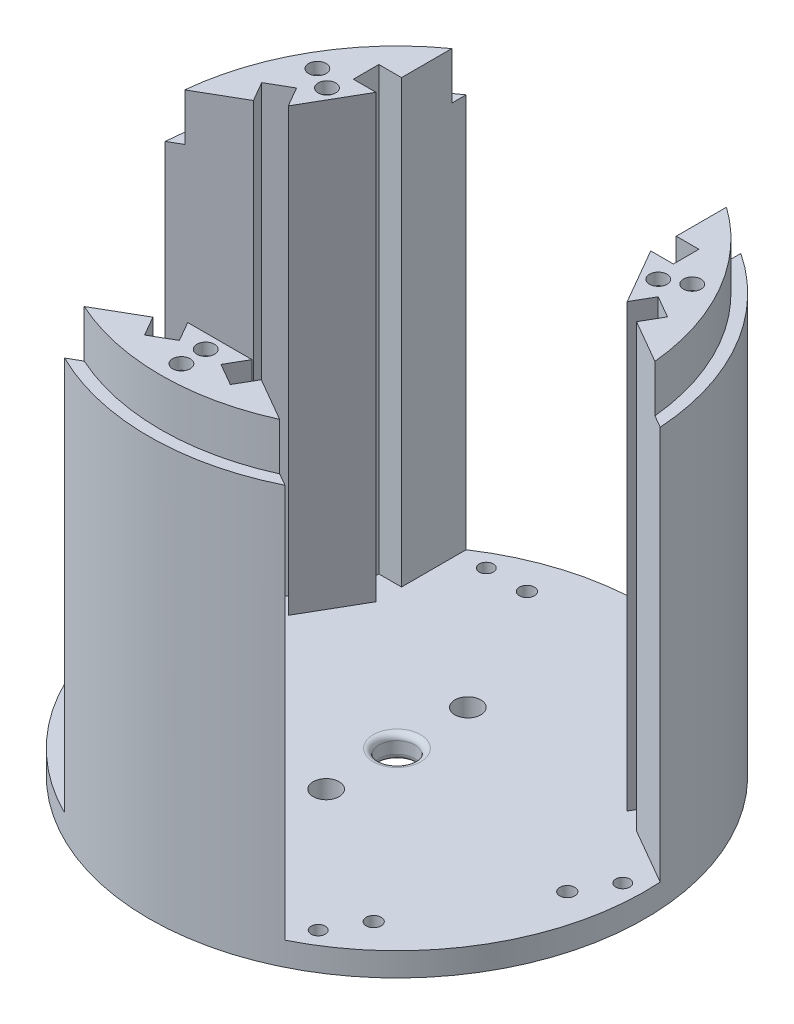
from build123d import *

# Parameters (mm, degrees)
SKETCH1_R             = 66.675
BOSS_EXTRUDE1_DEPTH   = 6.35
BOSS_EXTRUDE2_REACH   = 240.306
CIRPATTERN1_COUNT     = 3
CUT_EXTRUDE1_DEPTH    = 118.618
CIRPATTERN2_COUNT     = 3
CUT_EXTRUDE2_DEPTH    = 12.7
CIRPATTERN3_COUNT     = 3
HOLE1_D               = 4.0386
CIRPATTERN4_OUTLINE_R = 2.0193
CIRPATTERN4_DEPTH     = 6.35
HOLE2_D               = 9.525
FILLET1_R             = 1.5875
HOLE3_D               = 6.985
CIRPATTERN5_COUNT     = 3
HOLE5_D               = 3.7973
CIRPATTERN6_COUNT     = 3
CIRPATTERN7_COUNT     = 3


# Read off the part's stored shape, not the designer's step: CirPattern4
with BuildPart() as part:
    # Sketch1 → Boss-Extrude1 (new body)
    with BuildSketch(Plane(origin=(0, 0, 0), x_dir=(1, 0, 0), z_dir=(0, 1, 0))):
        with Locations(Location((0, 0, 0), (0, 0, 270))):
            Circle(SKETCH1_R)
    extrude(amount=BOSS_EXTRUDE1_DEPTH)

    # Sketch2 → Boss-Extrude2 (add, up to next)
    with BuildSketch(Plane(origin=(0, 124.968, -124.968), x_dir=(1, 0, 0), z_dir=(0, -1, 0)), mode=Mode.PRIVATE) as boss_extrude2_sk1:
        with BuildLine():
            Line((-29.614770643, 184.705098882), (-8.635999998, 172.593000013))
            Line((-8.635999998, 172.593000013), (8.636000002, 172.593000013))
            Line((8.636000002, 172.593000013), (29.61477065, 184.705098878))
            ThreePointArc((29.61477065, 184.705098878), (4e-09, 191.642999985), (-29.614770643, 184.705098882))
        make_face()
    boss_extrude2_tool1 = extrude(boss_extrude2_sk1.sketch, amount=BOSS_EXTRUDE2_REACH, mode=Mode.PRIVATE) - part.part
    boss_extrude2 = boss_extrude2_tool1.solids().sort_by_distance((0, 124.968, 57.682703))[0]
    add(boss_extrude2)

    # CirPattern1: Boss-Extrude2 ×3 about axis
    cirpattern1_axis = Axis((0, 0, 0), (0, 1, 0))
    for i in range(1, CIRPATTERN1_COUNT):
        add(boss_extrude2.rotate(cirpattern1_axis, i * 360 / CIRPATTERN1_COUNT))

    # Sketch4 → Cut-Extrude1 (cut)
    with BuildSketch(Plane(origin=(0, 124.968, 0), x_dir=(1, 0, 0), z_dir=(0, 1, 0))):
        Polygon((14.575202222, -51.054000013), (11.527202222, -56.333290875), (5.588000002, -52.904290875), (8.636000002, -47.625000013), align=None)
        Polygon((-14.575202225, -51.054000007), (-8.635999998, -47.625000013), (-5.587999998, -52.904290875), (-11.527202221, -56.333290877), align=None)
    cut_extrude1 = extrude(amount=-CUT_EXTRUDE1_DEPTH, mode=Mode.SUBTRACT)

    # CirPattern2: Cut-Extrude1 ×3 about axis
    cirpattern2_axis = Axis((0, 0, 0), (0, 1, 0))
    for i in range(1, CIRPATTERN2_COUNT):
        add(cut_extrude1.rotate(cirpattern2_axis, i * 360 / CIRPATTERN2_COUNT), mode=Mode.SUBTRACT)

    # Sketch5 → Cut-Extrude2 (cut)
    with BuildSketch(Plane(origin=(0, 124.968, 0), x_dir=(1, 0, 0), z_dir=(0, 1, 0))):
        with BuildLine():
            Line((29.61477065, -59.737098878), (26.275063747, -57.808918214))
            ThreePointArc((26.275063747, -57.808918214), (-4e-09, -63.5), (-26.275063755, -57.808918211))
            Line((-26.275063755, -57.808918211), (-29.614770643, -59.737098882))
            ThreePointArc((-29.614770643, -59.737098882), (4e-09, -66.674999985), (29.61477065, -59.737098878))
        make_face()
    cut_extrude2 = extrude(amount=-CUT_EXTRUDE2_DEPTH, mode=Mode.SUBTRACT)

    # CirPattern3: Cut-Extrude2 ×3 about axis
    cirpattern3_axis = Axis((0, 0, 0), (0, 1, 0))
    for i in range(1, CIRPATTERN3_COUNT):
        add(cut_extrude2.rotate(cirpattern3_axis, i * 360 / CIRPATTERN3_COUNT), mode=Mode.SUBTRACT)

    # Hole1 (through all)
    with Locations(Plane(origin=(0, 0, 0), x_dir=(-1, 0, 0), z_dir=(0, -1, 0))):
        with Locations((-19.05, 53.975), (19.05, 53.975)):
            Hole(HOLE1_D / 2)

    # CirPattern4 outline → CirPattern4 (cut)
    with BuildSketch(Plane(origin=(0, 0, 0), x_dir=(1, 0, 0), z_dir=(0, 1, 0))):
        with Locations((-37.218721169, -43.485283942)):
            Circle(CIRPATTERN4_OUTLINE_R)
        with Locations((-56.268721169, -10.489716058)):
            Circle(CIRPATTERN4_OUTLINE_R)
        with Locations((56.268721169, -10.489716058)):
            Circle(CIRPATTERN4_OUTLINE_R)
        with Locations((37.218721169, -43.485283942)):
            Circle(CIRPATTERN4_OUTLINE_R)
    extrude(amount=CIRPATTERN4_DEPTH, mode=Mode.SUBTRACT)

    # Hole2 (through all)
    with Locations(Plane(origin=(0, 6.35, 0), x_dir=(1, 0, 0), z_dir=(0, 1, 0))):
        with Locations((0, 0)):
            Hole(HOLE2_D / 2)

    # Fillet1
    fillet1_edges = [part.edges().sort_by_distance(p)[0] for p in [
        (4.7625, 6.35, 0),
        (4.7625, 0, 0),
    ]]
    fillet(fillet1_edges, radius=FILLET1_R)

    # Hole3 (through all)
    with Locations(Plane(origin=(0, 6.35, 0), x_dir=(1, 0, 0), z_dir=(0, 1, 0))):
        with Locations((0, 19.05), (0, -19.05)):
            Hole(HOLE3_D / 2)

    # Sketch19 → Hole4 (revolve, cut)
    with BuildSketch(Plane(origin=(-50.350429877, 124.968, -28.940765488), x_dir=(0, 0, 1), z_dir=(1, 0, 0))):
        Polygon((0, 0), (0, 7.525163199), (1.9558, 6.35), (1.9558, 3.175), (2.3622, 3.175), (2.3622, 0), align=None)
    hole4 = revolve(axis=Axis((-50.350429877, 131.318, -28.940765488), (0, -1, 0)), mode=Mode.SUBTRACT)

    # CirPattern5: Hole4 ×3 about axis
    cirpattern5_axis = Axis((0, 0, 0), (0, 1, 0))
    for i in range(1, CIRPATTERN5_COUNT):
        add(hole4.rotate(cirpattern5_axis, i * 360 / CIRPATTERN5_COUNT), mode=Mode.SUBTRACT)

    # Hole5 (through all)
    with Locations(Plane(origin=(0, 6.35, 0), x_dir=(1, 0, 0), z_dir=(0, 1, 0))):
        with Locations((-29.972, 53.975), (29.972, 53.975)):
            hole5 = Hole(HOLE5_D / 2)

    # CirPattern6: Hole5 ×3 about axis
    cirpattern6_axis = Axis((0, 0, 0), (0, 1, 0))
    for i in range(1, CIRPATTERN6_COUNT):
        add(hole5.rotate(cirpattern6_axis, i * 360 / CIRPATTERN6_COUNT), mode=Mode.SUBTRACT)

    # Sketch23 → Hole6 (revolve, cut)
    with BuildSketch(Plane(origin=(0, 124.968, 51.435), x_dir=(0, 0, 1), z_dir=(1, 0, 0))):
        Polygon((0, 0), (0, 5.239163199), (1.9558, 4.064), (1.9558, 3.175), (2.3622, 3.175), (2.3622, 0), align=None)
    hole6 = revolve(axis=Axis((0, 131.318, 51.435), (0, -1, 0)), mode=Mode.SUBTRACT)

    # CirPattern7: Hole6 ×3 about axis
    cirpattern7_axis = Axis((0, 0, 0), (0, 1, 0))
    for i in range(1, CIRPATTERN7_COUNT):
        add(hole6.rotate(cirpattern7_axis, i * 360 / CIRPATTERN7_COUNT), mode=Mode.SUBTRACT)


solid = part.part
